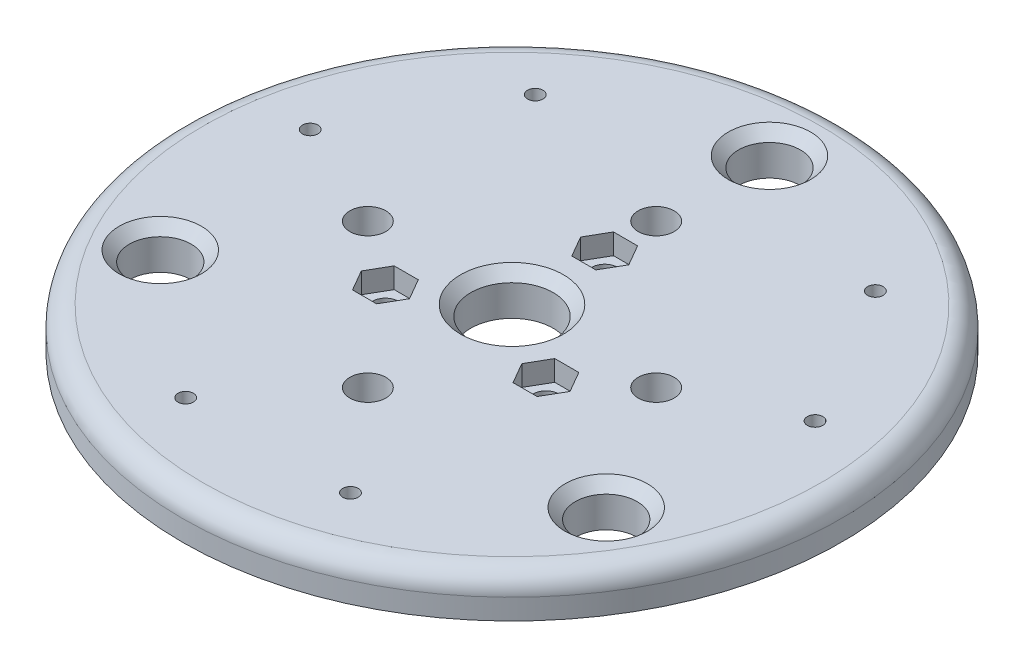
from build123d import *

# Parameters (mm, degrees)
SKETCH_1_R          = 32
SKETCH_1_R_2        = 4
SKETCH_1_R_3        = 3
EXTRUDE_1_DEPTH     = 4
FILLET_1_R          = 2
SKETCH_2_R          = 1.25
CUT_EXTRUDE_1_DEPTH = 46.431266766
SKETCH_3_R          = 1.75
CUT_EXTRUDE_2_DEPTH = 46.431266766
CUT_EXTRUDE_3_DEPTH = 2
CHAMFER_1_SIZE      = 1
SKETCH_5_R          = 0.75
CUT_EXTRUDE_4_DEPTH = 46.431266766


with BuildPart() as part:
    # Эскиз1 → Бобышка-Вытянуть1 (new body)
    with BuildSketch(Plane(origin=(0, 0, 0), x_dir=(1, 0, 0), z_dir=(0, 1, 0))):
        Circle(SKETCH_1_R)
        Circle(SKETCH_1_R_2, mode=Mode.SUBTRACT)
        with Locations((0, 25)):
            Circle(SKETCH_1_R_3, mode=Mode.SUBTRACT)
        with Locations((21.650635095, -12.5)):
            Circle(SKETCH_1_R_3, mode=Mode.SUBTRACT)
        with Locations((-21.650635095, -12.5)):
            Circle(SKETCH_1_R_3, mode=Mode.SUBTRACT)
    extrude(amount=EXTRUDE_1_DEPTH)

    # Скругление1
    fillet_1_edges = [part.edges().sort_by_distance(p)[0] for p in [
        (-32, 4, 0),
    ]]
    fillet(fillet_1_edges, radius=FILLET_1_R)

    # Эскиз2 → Вырез-Вытянуть1 (cut, through all)
    with BuildSketch(Plane(origin=(0, 4, 0), x_dir=(1, 0, 0), z_dir=(0, 1, 0))):
        with Locations((0, 9)):
            Circle(SKETCH_2_R)
        with Locations((7.794228634, -4.5)):
            Circle(SKETCH_2_R)
        with Locations((-7.794228634, -4.5)):
            Circle(SKETCH_2_R)
    extrude(amount=-CUT_EXTRUDE_1_DEPTH, mode=Mode.SUBTRACT)

    # Эскиз3 → Вырез-Вытянуть2 (cut, through all)
    with BuildSketch(Plane.XZ):
        with Locations((0, 14)):
            Circle(SKETCH_3_R)
        with Locations((14, 0)):
            Circle(SKETCH_3_R)
        with Locations((0, -14)):
            Circle(SKETCH_3_R)
        with Locations((-14, 0)):
            Circle(SKETCH_3_R)
    extrude(amount=-CUT_EXTRUDE_2_DEPTH, mode=Mode.SUBTRACT)

    # Эскиз4 → Вырез-Вытянуть3 (cut)
    with BuildSketch(Plane(origin=(0, 4, 0), x_dir=(1, 0, 0), z_dir=(0, 1, 0))):
        Polygon((5.455960044, -4.5), (6.625094339, -6.525), (8.963362929, -6.525), (10.132497224, -4.5), (8.963362929, -2.475), (6.625094339, -2.475), align=None)
        Polygon((1.169134295, 6.975), (2.33826859, 9), (1.169134295, 11.025), (-1.169134295, 11.025), (-2.33826859, 9), (-1.169134295, 6.975), align=None)
        Polygon((-6.625094339, -2.475), (-8.963362929, -2.475), (-10.132497224, -4.5), (-8.963362929, -6.525), (-6.625094339, -6.525), (-5.455960044, -4.5), align=None)
    extrude(amount=-CUT_EXTRUDE_3_DEPTH, mode=Mode.SUBTRACT)

    # Фаска1
    chamfer_1_edges = [part.edges().sort_by_distance(p)[0] for p in [
        (-3, 4, -25),
        (18.650635095, 4, 12.5),
        (-24.650635095, 4, 12.5),
        (-4, 4, 0),
    ]]
    chamfer(chamfer_1_edges, length=CHAMFER_1_SIZE)

    # Эскиз5 → Вырез-Вытянуть4 (cut, through all)
    with BuildSketch(Plane(origin=(0, 4, 0), x_dir=(1, 0, 0), z_dir=(0, 1, 0))):
        with Locations((-8, -23.685438565)):
            Circle(SKETCH_5_R)
        with Locations((8, -23.685438565)):
            Circle(SKETCH_5_R)
        with Locations((-16.512191497, 18.770922513)):
            Circle(SKETCH_5_R)
        with Locations((-24.512191497, 4.914516052)):
            Circle(SKETCH_5_R)
        with Locations((24.512191497, 4.914516052)):
            Circle(SKETCH_5_R)
        with Locations((16.512191497, 18.770922513)):
            Circle(SKETCH_5_R)
    extrude(amount=-CUT_EXTRUDE_4_DEPTH, mode=Mode.SUBTRACT)


solid = part.part
